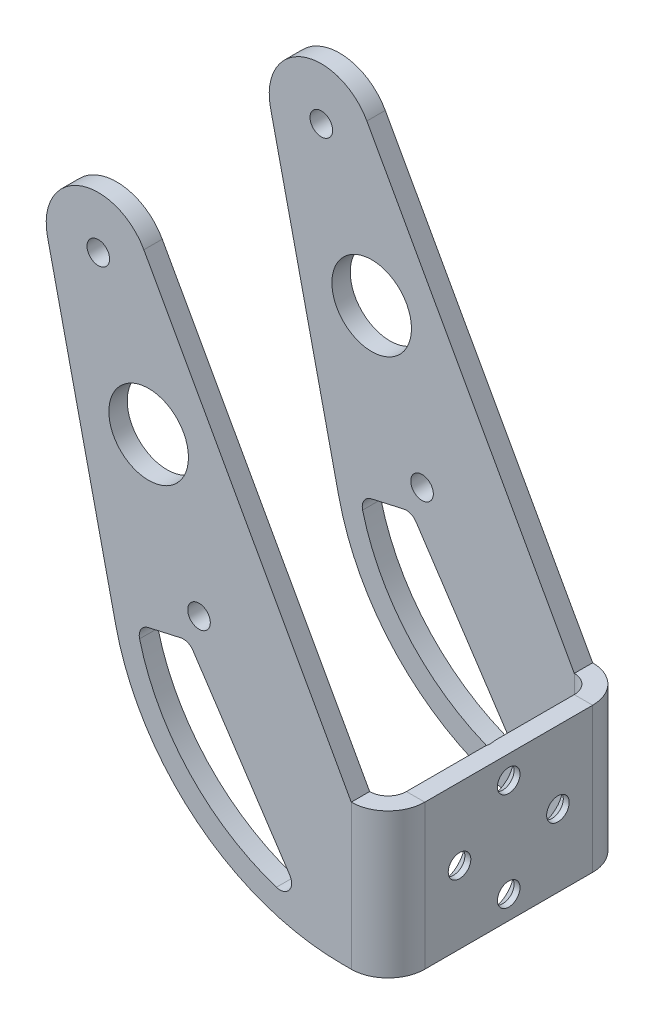
from build123d import *

# Parameters (mm, degrees)
SKETCH2_W                                      = 29
SKETCH2_H                                      = 25
BOSS_EXTRUDE1_DEPTH                            = 6.35
CONVERT_SOLID1_START                           = 3.175
CONVERT_SOLID1_OUTLINE_W                       = 25
CONVERT_SOLID1_OUTLINE_H                       = 29
CONVERT_SOLID1_DEPTH                           = 3.175
CSK_FOR_M3_5_FLAT_HEAD_MACHINE_SCREW1_AT_COUNT = 2
CSK_FOR_M3_5_FLAT_HEAD_MACHINE_SCREW1_AT_PITCH = 12.02081528
CSK_FOR_M3_5_FLAT_HEAD_MACHINE_SCREW_2_COUNT   = 2
CSK_FOR_M3_5_FLAT_HEAD_MACHINE_SCREW_2_PITCH   = 17
CSK_FOR_M3_5_FLAT_HEAD_MACHINE_SCREW_3_COUNT   = 2
CSK_FOR_M3_5_FLAT_HEAD_MACHINE_SCREW_3_PITCH   = 12.02081528
EDGE_FLANGE1_DEPTH                             = 25
EDGE_FLANGE1_BEND_DEPTH                        = 25
SKETCH23_R                                     = 1.95
SKETCH23_R_2                                   = 6.875
BOSS_EXTRUDE2_DEPTH                            = 3.175
FILLET1_R                                      = 40
SKETCH25_R                                     = 1.95
SKETCH25_R_2                                   = 6.875
CUT_EXTRUDE3_DEPTH                             = 108.532674661
FILLET2_R                                      = 2


# Read off the part's stored shape, not the designer's step: Convert-Solid1
# Sheet-metal steps are written as plain solids
with BuildPart() as part:
    # Sketch2 → Boss-Extrude1 (new body)
    with BuildSketch(Plane(origin=(0, 0, 0), x_dir=(0, 0, -1), z_dir=(1, 0, 0))):
        Rectangle(SKETCH2_W, SKETCH2_H)
    extrude(amount=BOSS_EXTRUDE1_DEPTH)

    # Convert-Solid1 outline → Convert-Solid1 (cut)
    with BuildSketch(Plane.YZ.offset(CONVERT_SOLID1_START)):
        Rectangle(CONVERT_SOLID1_OUTLINE_W, CONVERT_SOLID1_OUTLINE_H)
    extrude(amount=CONVERT_SOLID1_DEPTH, mode=Mode.SUBTRACT)

    # Sketch4 → CSK for M3.5 Flat Head Machine Screw1 (revolve, cut)
    with BuildSketch(Plane.ZX.offset(-8.5)):
        Polygon((0, 0), (0, 3.175), (1.95, 3.175), (1.95, 2.15), (4.1, 0), align=None)
    csk_for_m3_5_flat_head_machine_screw1 = revolve(axis=Axis((-6.35, -8.5, 0), (1, 0, 0)), mode=Mode.SUBTRACT)

    # CSK for M3.5 Flat Head Machine Screw1 at: CSK for M3.5 Flat Head Machine Screw1 ×2
    with Locations(*[Vector(0, 0.7071067811865476, 0.7071067811865476) * (i * CSK_FOR_M3_5_FLAT_HEAD_MACHINE_SCREW1_AT_PITCH) for i in range(1, CSK_FOR_M3_5_FLAT_HEAD_MACHINE_SCREW1_AT_COUNT)]):
        add(csk_for_m3_5_flat_head_machine_screw1, mode=Mode.SUBTRACT)

    # CSK for M3.5 Flat Head Machine Screw 2: CSK for M3.5 Flat Head Machine Screw1 ×2
    with Locations(*[(0, i * CSK_FOR_M3_5_FLAT_HEAD_MACHINE_SCREW_2_PITCH, 0) for i in range(1, CSK_FOR_M3_5_FLAT_HEAD_MACHINE_SCREW_2_COUNT)]):
        add(csk_for_m3_5_flat_head_machine_screw1, mode=Mode.SUBTRACT)

    # CSK for M3.5 Flat Head Machine Screw 3: CSK for M3.5 Flat Head Machine Screw1 ×2
    with Locations(*[Vector(0, 0.7071067811865476, -0.7071067811865476) * (i * CSK_FOR_M3_5_FLAT_HEAD_MACHINE_SCREW_3_PITCH) for i in range(1, CSK_FOR_M3_5_FLAT_HEAD_MACHINE_SCREW_3_COUNT)]):
        add(csk_for_m3_5_flat_head_machine_screw1, mode=Mode.SUBTRACT)

    # Edge-Flange1 section (across the edge) → Edge-Flange1 (add)
    with BuildSketch(Plane(origin=(0, 12.5, -17.675), x_dir=(0, 0, 1), z_dir=(0, -1, 0))):
        with BuildLine():
            Line((-3.175, 3.175), (-3.175, 36.825))
            Line((-3.175, 36.825), (0, 36.825))
            Line((0, 36.825), (0, 3.175))
            ThreePointArc((0, 3.175), (0.92993597, 0.92993597), (3.175, 0))
            Line((3.175, 0), (3.175, -3.175))
            ThreePointArc((3.175, -3.175), (-1.315128061, -1.315128061), (-3.175, 3.175))
        make_face()
    extrude(amount=EDGE_FLANGE1_DEPTH)

    # Edge-Flange1 section 2 (across the edge) → Edge-Flange1 bend (add)
    with BuildSketch(Plane(origin=(0, -12.5, 17.675), x_dir=(0, 0, -1), z_dir=(0, 1, 0))):
        with BuildLine():
            Line((-3.175, 3.175), (-3.175, 36.825))
            Line((-3.175, 36.825), (0, 36.825))
            Line((0, 36.825), (0, 3.175))
            ThreePointArc((0, 3.175), (0.92993597, 0.92993597), (3.175, 0))
            Line((3.175, 0), (3.175, -3.175))
            ThreePointArc((3.175, -3.175), (-1.315128061, -1.315128061), (-3.175, 3.175))
        make_face()
    extrude(amount=EDGE_FLANGE1_BEND_DEPTH)

    # Sketch23 → Boss-Extrude2 (add)
    with BuildSketch(Plane.XY.offset(20.85)):
        with BuildLine():
            Line((-3.175, -12.5), (-3.175, 12.5))
            Line((-3.175, 12.5), (-39.000765285, 77.226355048))
            ThreePointArc((-39.000765285, 77.226355048), (-50.077531286, 81.278922457), (-55.654025191, 70.885618681))
            Line((-55.654025191, 70.885618681), (-36.825, -12.5))
            Line((-36.825, -12.5), (-3.175, -12.5))
        make_face()
        with Locations((-46.875056501, 72.867967978)):
            Circle(SKETCH23_R, mode=Mode.SUBTRACT)
        with Locations((-29.474943499, 27.168448642)):
            Circle(SKETCH23_R, mode=Mode.SUBTRACT)
        with Locations((-38.175, 50.01820831)):
            Circle(SKETCH23_R_2, mode=Mode.SUBTRACT)
    boss_extrude2 = extrude(amount=-BOSS_EXTRUDE2_DEPTH)

    # Mirror3: Boss-Extrude2 across plane
    add(boss_extrude2.mirror(Plane.XY))

    # Fillet1
    fillet1_edges = [part.edges().sort_by_distance(p)[0] for p in [
        (-36.825, -12.5, -19.2625),
        (-36.825, -12.5, 19.2625),
    ]]
    fillet(fillet1_edges, radius=FILLET1_R)

    # Sketch25 → Cut-Extrude3 (cut, through all)
    with BuildSketch(Plane.XY.offset(20.85)):
        with Locations((-46.875056501, 72.867967978)):
            Circle(SKETCH25_R)
        with Locations((-38.175, 50.01820831)):
            Circle(SKETCH25_R_2)
        with Locations((-29.474943499, 27.168448642)):
            Circle(SKETCH25_R)
        with BuildLine():
            Line((-40.192024973, 20.647751172), (-31.28455236, 22.659117506))
            Line((-31.28455236, 22.659117506), (-10.974113473, -7.975305792))
            ThreePointArc((-10.974113473, -7.975305792), (-30.042886429, 1.783719979), (-40.192024973, 20.647751172))
        make_face()
    extrude(amount=-CUT_EXTRUDE3_DEPTH, mode=Mode.SUBTRACT)

    # Fillet2
    fillet2_edges = [part.edges().sort_by_distance(p)[0] for p in [
        (-31.28455236, 22.659117506, 19.2625),
        (-10.974113473, -7.975305792, 19.2625),
        (-40.192024973, 20.647751172, 19.2625),
        (-31.28455236, 22.659117506, -19.2625),
        (-10.974113473, -7.975305792, -19.2625),
        (-40.192024973, 20.647751172, -19.2625),
    ]]
    fillet(fillet2_edges, radius=FILLET2_R)


solid = part.part
